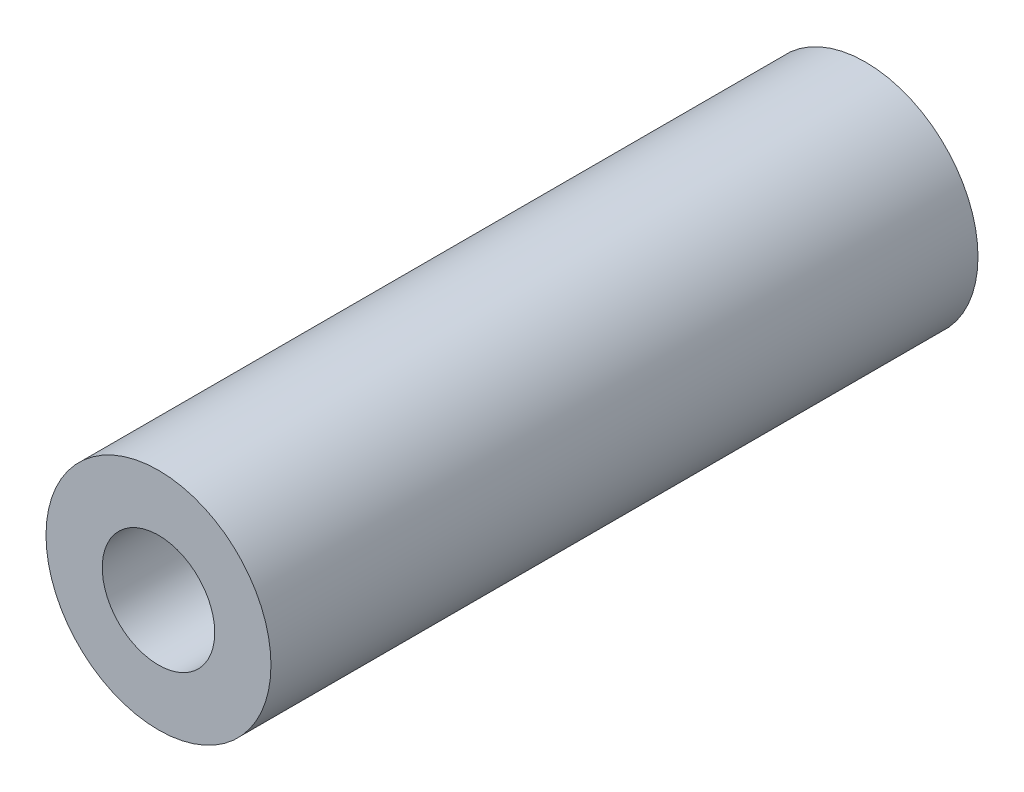
from build123d import *

# Parameters (mm, degrees)
SKETCH1_R           = 3.5
SKETCH1_R_2         = 1.75
BOSS_EXTRUDE1_DEPTH = 22


with BuildPart() as part:
    # Sketch1 → Boss-Extrude1 (new body)
    with BuildSketch(Plane.XY):
        Circle(SKETCH1_R)
        Circle(SKETCH1_R_2, mode=Mode.SUBTRACT)
    extrude(amount=BOSS_EXTRUDE1_DEPTH)


solid = part.part
